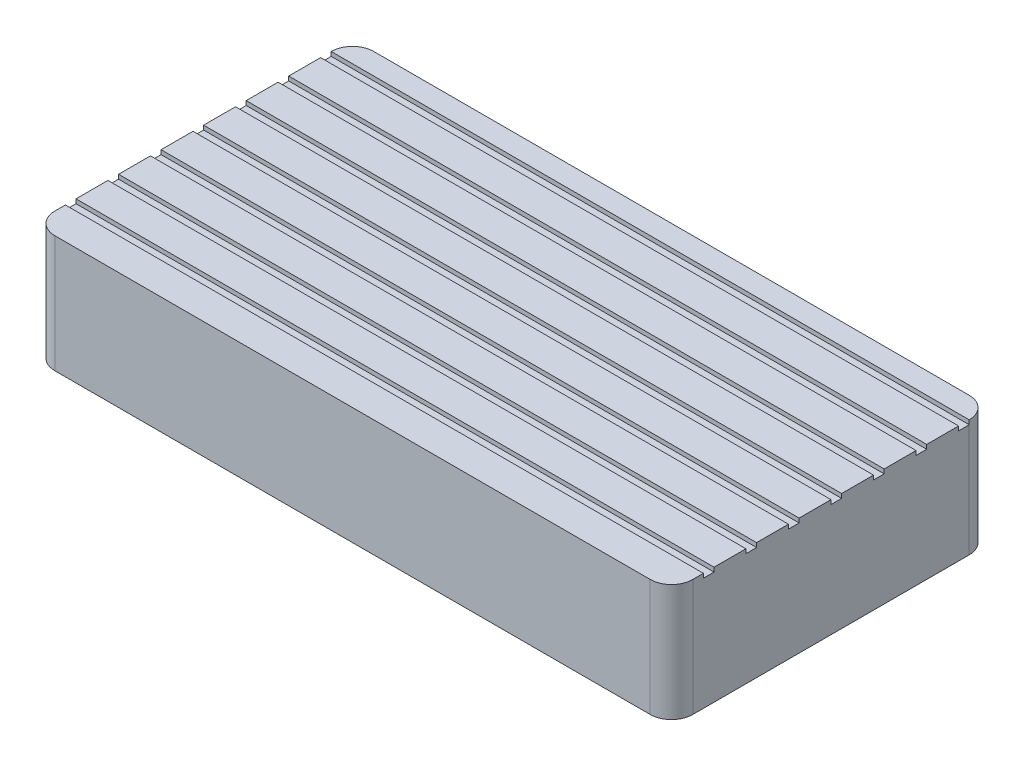
from build123d import *

# Parameters (mm, degrees)
SKETCH1_W               = 30
SKETCH1_H               = 15
BOSS_EXTRUDE1_DEPTH     = 5.5
CUT_EXTRUDE2_DEPTH      = 18.649362595
CUT_EXTRUDE2_DEPTH_BACK = 18.649362595
SKETCH2_W               = 0.5
SKETCH2_H               = 0.2
FILLET1_R               = 1


with BuildPart() as part:
    # Sketch1 → Boss-Extrude1 (new body)
    with BuildSketch(Plane(origin=(0, 0, 0), x_dir=(1, 0, 0), z_dir=(0, 1, 0))):
        Rectangle(SKETCH1_W, SKETCH1_H)
    extrude(amount=BOSS_EXTRUDE1_DEPTH)

    # Sketch2 → Cut-Extrude2 (cut, two sides: drawn at the far end of the back side and taken through both)
    with BuildSketch(Plane(origin=(0, 0, 0), x_dir=(0, 0, -1), z_dir=(1, 0, 0)).offset(-CUT_EXTRUDE2_DEPTH_BACK)):
        with Locations((-5.75, 5.4)):
            Rectangle(SKETCH2_W, SKETCH2_H)
        with Locations((-3.75, 5.4)):
            Rectangle(SKETCH2_W, SKETCH2_H)
        with Locations((-1.75, 5.4)):
            Rectangle(SKETCH2_W, SKETCH2_H)
        with Locations((0.25, 5.4)):
            Rectangle(SKETCH2_W, SKETCH2_H)
        with Locations((2.25, 5.4)):
            Rectangle(SKETCH2_W, SKETCH2_H)
        with Locations((4.25, 5.4)):
            Rectangle(SKETCH2_W, SKETCH2_H)
        with Locations((6.25, 5.4)):
            Rectangle(SKETCH2_W, SKETCH2_H)
    extrude(amount=CUT_EXTRUDE2_DEPTH + CUT_EXTRUDE2_DEPTH_BACK, mode=Mode.SUBTRACT)

    # Sketch8 → Cut-Revolve1 (revolve, cut)
    with BuildSketch(Plane.XY.offset(4), mode=Mode.PRIVATE) as cut_revolve1_sk:
        Polygon((10.25, 0), (10.25, 3), (9, 3.721687836), (9, 0), align=None)
    cut_revolve1 = revolve(cut_revolve1_sk.sketch.rotate(Axis((9, 0, 4), (0, 1, 0)), 90), axis=Axis((9, 0, 4), (0, 1, 0)), mode=Mode.SUBTRACT)

    # Mirror1: Cut-Revolve1 across plane
    add(cut_revolve1.mirror(Plane.XY), mode=Mode.SUBTRACT)

    # Mirror2: Cut-Revolve1 across plane
    add(cut_revolve1.mirror(Plane(origin=(0, 0, 0), x_dir=(0, 0, 1), z_dir=(1, 0, 0))), mode=Mode.SUBTRACT)

    # Mirror2 copy 1 sketch → Mirror2 copy 1 (revolve, cut)
    with BuildSketch(Plane(origin=(0, 0, -4), x_dir=(-1, 0, 0), z_dir=(0, 0, -1))):
        Polygon((10.25, 0), (10.25, 3), (9, 3.721687836), (9, 0), align=None)
    revolve(axis=Axis((-9, 0, -4), (0, 1, 0)), mode=Mode.SUBTRACT)

    # Sketch9 → Cut-Revolve2 (revolve, cut)
    with BuildSketch(Plane.XY, mode=Mode.PRIVATE) as cut_revolve2_sk:
        Polygon((-15, 2.5), (-7.678312164, 2.5), (-8.4, 3.75), (-15, 3.75), align=None)
    revolve(cut_revolve2_sk.sketch.rotate(Axis((-15, 2.5, 0), (-1, 0, 0)), 180), axis=Axis((-15, 2.5, 0), (-1, 0, 0)), mode=Mode.SUBTRACT)

    # Fillet1
    fillet1_edges = [part.edges().sort_by_distance(p)[0] for p in [
        (-15, 2.75, -7.5),
        (15, 2.75, -7.5),
        (15, 2.75, 7.5),
        (-15, 2.75, 7.5),
    ]]
    fillet(fillet1_edges, radius=FILLET1_R - 0.0001)  # a hair under: the kernel refuses the full size


solid = part.part
